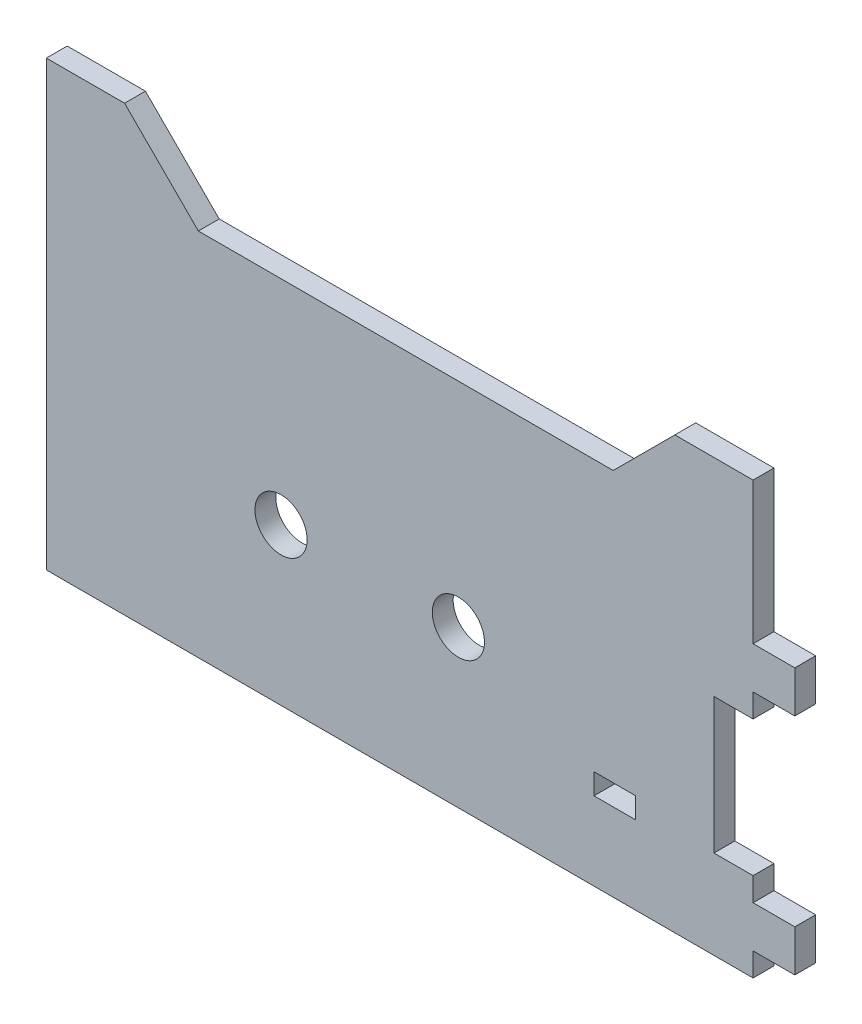
from build123d import *

# Parameters (mm, degrees)
SKETCH1_R           = 5
SKETCH1_W           = 8
SKETCH1_H           = 4
BOSS_EXTRUDE1_DEPTH = 4
BOSS_EXTRUDE2_DEPTH = 4


with BuildPart() as part:
    # Sketch1 → Boss-Extrude1 (new body)
    with BuildSketch(Plane.XY):
        Polygon((49, 30), (56.5, 30), (56.5, 25.5), (64.5, 25.5), (64.5, 17.5), (56.5, 17.5), (56.5, 13), (49, 13), (49, -13), (56.5, -13), (56.5, -17.5), (64.5, -17.5), (64.5, -25.5), (56.5, -25.5), (56.5, -30), (49, -30), (-79, -30), (-79, 30), align=None)
        Circle(SKETCH1_R, mode=Mode.SUBTRACT)
        with Locations((-34, 0)):
            Circle(SKETCH1_R, mode=Mode.SUBTRACT)
        with Locations((30, -13)):
            Rectangle(SKETCH1_W, SKETCH1_H, mode=Mode.SUBTRACT)
    extrude(amount=BOSS_EXTRUDE1_DEPTH)

    # Sketch2 → Boss-Extrude2 (add)
    with BuildSketch(Plane.XY):
        Polygon((-79, 30), (56.5, 30), (56.5, 52.677917314), (41.5, 52.677917314), (29.679947063, 40.857864376), (-49.857864376, 40.857864376), (-64, 55), (-79, 55), align=None)
    extrude(amount=BOSS_EXTRUDE2_DEPTH)


solid = part.part
